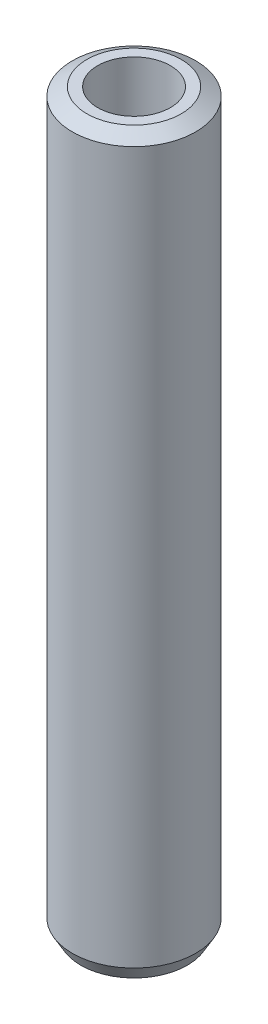
from build123d import *
from OCP.BRepFilletAPI import BRepFilletAPI_MakeChamfer

# Parameters (mm, degrees)
SKETCH1_R           = 25
BOSS_EXTRUDE1_DEPTH = 297.604528578
SKETCH2_R           = 14.753610794
CUT_EXTRUDE1_DEPTH  = 300.697272977
CHAMFER1_SIZE       = 3.400354087
CHAMFER1_SIZE2      = 5.889586042


with BuildPart() as part:
    # Sketch1 → Boss-Extrude1 (new body)
    with BuildSketch(Plane(origin=(0, 0, 0), x_dir=(1, 0, 0), z_dir=(0, 1, 0))):
        Circle(SKETCH1_R)
    extrude(amount=BOSS_EXTRUDE1_DEPTH)

    # Sketch2 → Cut-Extrude1 (cut, through all)
    with BuildSketch(Plane(origin=(0, 0, 0), x_dir=(1, 0, 0), z_dir=(0, 1, 0))):
        Circle(SKETCH2_R)
    extrude(amount=CUT_EXTRUDE1_DEPTH, mode=Mode.SUBTRACT)

    # Chamfer1: one chamfer whose edges measure the first distance from different faces: ONE call of the kernel's chamfer builder (chamfer() names one face for all edges)
    chamfer1_edges_1 = [part.edges().sort_by_distance(p)[0] for p in [
        (-25, 297.604528578, 0),
    ]]
    chamfer1_side_1 = [part.faces().sort_by_distance(p)[0] for p in [
        (-25, 148.802264289, 0),
    ]]
    chamfer1_edges_2 = [part.edges().sort_by_distance(p)[0] for p in [
        (-25, 0, 0),
    ]]
    chamfer1_side_2 = [part.faces().sort_by_distance(p)[0] for p in [
        (-24.292893219, 0, 0),
    ]]
    chamfer1 = BRepFilletAPI_MakeChamfer(part.part.solid().wrapped)
    for e in chamfer1_edges_1:
        chamfer1.Add(CHAMFER1_SIZE, CHAMFER1_SIZE2, e.wrapped, chamfer1_side_1[0].wrapped)  # the first distance lies on this face
    for e in chamfer1_edges_2:
        chamfer1.Add(CHAMFER1_SIZE, CHAMFER1_SIZE2, e.wrapped, chamfer1_side_2[0].wrapped)  # the first distance lies on this face
    add(Compound.cast(chamfer1.Shape()), mode=Mode.REPLACE)


solid = part.part
